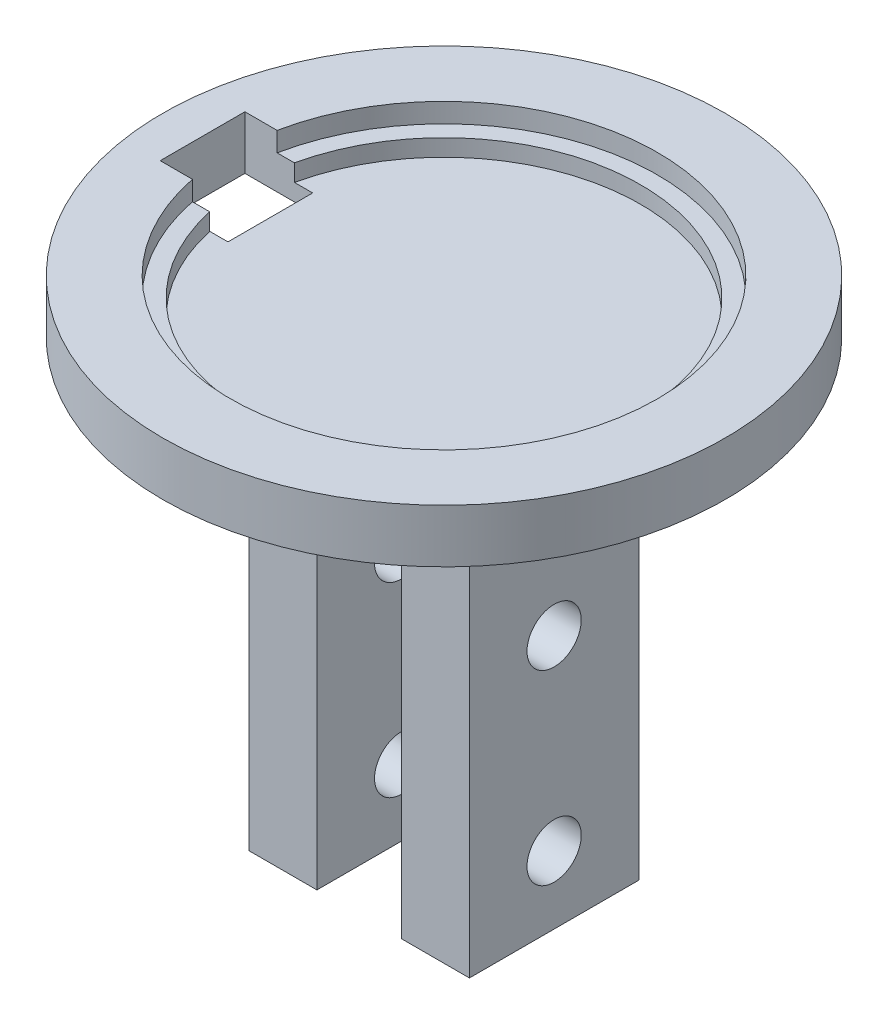
from build123d import *

# Parameters (mm, degrees)
SKETCH2_W           = 4
SKETCH2_H           = 10
BOSS_EXTRUDE1_DEPTH = 27
SKETCH3_R           = 1.6
CUT_EXTRUDE1_DEPTH  = 22.3
FILLET1_R           = 2.75
SKETCH6_W           = 4
SKETCH6_H           = 5
CUT_EXTRUDE4_DEPTH  = 10


with BuildPart() as part:
    # Sketch1 → Revolve1 (revolve)
    with BuildSketch(Plane.XY, mode=Mode.PRIVATE) as revolve1_sk:
        Polygon((-14.45, -3.342), (-10.45, -3.342), (-10.45, -4.492), (-9.45, -4.492), (-9.45, -5.492), (2.15, -5.492), (2.15, -6.492), (-14.45, -6.492), align=None)
    revolve(revolve1_sk.sketch.rotate(Axis((2.15, -6.492, 0), (0, 1, 0)), 270), axis=Axis((2.15, -6.492, 0), (0, 1, 0)))

    # Sketch2 → Boss-Extrude1 (add)
    with BuildSketch(Plane.XZ.offset(6.492)):
        with Locations((6.65, 0)):
            Rectangle(SKETCH2_W, SKETCH2_H)
        with Locations((-2.35, 0)):
            Rectangle(SKETCH2_W, SKETCH2_H)
    extrude(amount=BOSS_EXTRUDE1_DEPTH)

    # Sketch3 → Cut-Extrude1 (cut)
    with BuildSketch(Plane.ZY.offset(4.35)):
        with Locations((0, -29.492)):
            Circle(SKETCH3_R)
        with Locations((0, -18.492)):
            Circle(SKETCH3_R)
    extrude(amount=-CUT_EXTRUDE1_DEPTH, mode=Mode.SUBTRACT)

    # Fillet1
    # the kernel refuses this fillet: 2.75 mm, written as the material it adds along each edge
    with BuildSketch(Plane(origin=(-4.35, -6.492, -5), x_dir=(-1, 0, 0), z_dir=(0, 0, 1)), Plane(origin=(-0.35, -6.492, 5), x_dir=(1, 0, 0), z_dir=(0, 0, -1)), Plane(origin=(8.65, -6.492, 5), x_dir=(1, 0, 0), z_dir=(0, 0, -1)), Plane(origin=(4.65, -6.492, -5), x_dir=(-1, 0, 0), z_dir=(0, 0, 1))) as fillet1_piece_1:
        with BuildLine():
            CenterArc((FILLET1_R, FILLET1_R), FILLET1_R, 180, 90)
            Line((0, FILLET1_R), (0, 0))
            Line((0, 0), (FILLET1_R, 0))
        make_face()
    extrude(amount=10)
    with BuildSketch(Plane(origin=(6.525, -6.492, -5), x_dir=(0, 0, -1), z_dir=(-1, 0, 0))) as fillet1_piece_2_section:
        with BuildLine():
            CenterArc((FILLET1_R, FILLET1_R), FILLET1_R, 180, 90)
            Line((0, FILLET1_R), (0, 0))
            Line((0, 0), (FILLET1_R, 0))
        make_face()
    fillet1_piece_2 = extrude(amount=10.875, mode=Mode.PRIVATE)
    fillet1_piece_2 = split(fillet1_piece_2, bisect_by=Plane(origin=(4.65, -7.114586564, -5.622586564), z_dir=(1, 0, 0)), keep=Keep.TOP, mode=Mode.PRIVATE)
    add(fillet1_piece_2)
    with BuildSketch(Plane(origin=(-0.35, -6.492, -5), x_dir=(0, 0, -1), z_dir=(-1, 0, 0)), Plane(origin=(-4.35, -6.492, 5), x_dir=(0, 0, 1), z_dir=(1, 0, 0)), Plane(origin=(4.65, -6.492, 5), x_dir=(0, 0, 1), z_dir=(1, 0, 0)), Plane(origin=(8.65, -6.492, -5), x_dir=(0, 0, -1), z_dir=(-1, 0, 0))) as fillet1_piece_3:
        with BuildLine():
            CenterArc((FILLET1_R, FILLET1_R), FILLET1_R, 180, 90)
            Line((0, FILLET1_R), (0, 0))
            Line((0, 0), (FILLET1_R, 0))
        make_face()
    extrude(amount=4)
    with BuildSketch(Plane(origin=(-4.35, -6.492, 5), x_dir=(0, 0, 1), z_dir=(1, 0, 0))) as fillet1_piece_4_section:
        with BuildLine():
            CenterArc((FILLET1_R, FILLET1_R), FILLET1_R, 180, 90)
            Line((0, FILLET1_R), (0, 0))
            Line((0, 0), (FILLET1_R, 0))
        make_face()
    fillet1_piece_4 = extrude(amount=10.875, mode=Mode.PRIVATE)
    fillet1_piece_4 = split(fillet1_piece_4, bisect_by=Plane(origin=(4.65, -7.114586564, 5.622586564), z_dir=(1, 0, 0)), keep=Keep.TOP, mode=Mode.PRIVATE)
    add(fillet1_piece_4)
    with BuildSketch(Plane(origin=(-2.225, -6.492, 5), x_dir=(0, 0, 1), z_dir=(1, 0, 0))) as fillet1_piece_5_section:
        with BuildLine():
            CenterArc((FILLET1_R, FILLET1_R), FILLET1_R, 180, 90)
            Line((0, FILLET1_R), (0, 0))
            Line((0, 0), (FILLET1_R, 0))
        make_face()
    fillet1_piece_5 = extrude(amount=10.875, mode=Mode.PRIVATE)
    fillet1_piece_5 = split(fillet1_piece_5, bisect_by=Plane(origin=(-0.35, -7.114586564, 5.622586564), z_dir=(-1, 0, 0)), keep=Keep.TOP, mode=Mode.PRIVATE)
    add(fillet1_piece_5)
    with BuildSketch(Plane(origin=(8.65, -6.492, -5), x_dir=(0, 0, -1), z_dir=(-1, 0, 0))) as fillet1_piece_6_section:
        with BuildLine():
            CenterArc((FILLET1_R, FILLET1_R), FILLET1_R, 180, 90)
            Line((0, FILLET1_R), (0, 0))
            Line((0, 0), (FILLET1_R, 0))
        make_face()
    fillet1_piece_6 = extrude(amount=10.875, mode=Mode.PRIVATE)
    fillet1_piece_6 = split(fillet1_piece_6, bisect_by=Plane(origin=(-0.35, -7.114586564, -5.622586564), z_dir=(-1, 0, 0)), keep=Keep.TOP, mode=Mode.PRIVATE)
    add(fillet1_piece_6)
    with BuildSketch(Plane(origin=(-4.35, -6.492, -11.875), x_dir=(-1, 0, 0), z_dir=(0, 0, 1))) as fillet1_piece_7a_section:
        with BuildLine():
            CenterArc((FILLET1_R, FILLET1_R), FILLET1_R, 180, 90)
            Line((0, FILLET1_R), (0, 0))
            Line((0, 0), (FILLET1_R, 0))
        make_face()
    fillet1_piece_7a = extrude(amount=16.875, mode=Mode.PRIVATE)
    fillet1_piece_7a = split(fillet1_piece_7a, bisect_by=Plane(origin=(-4.972586564, -7.114586564, -5), z_dir=(0, 0, -1)), keep=Keep.TOP, mode=Mode.PRIVATE)
    with BuildSketch(Plane(origin=(-0.35, -6.492, -5), x_dir=(0, 0, -1), z_dir=(-1, 0, 0))) as fillet1_piece_7b_section:
        with BuildLine():
            CenterArc((FILLET1_R, FILLET1_R), FILLET1_R, 180, 90)
            Line((0, FILLET1_R), (0, 0))
            Line((0, 0), (FILLET1_R, 0))
        make_face()
    fillet1_piece_7b = extrude(amount=10.875, mode=Mode.PRIVATE)
    fillet1_piece_7b = split(fillet1_piece_7b, bisect_by=Plane(origin=(-4.35, -7.114586564, -5.622586564), z_dir=(-1, 0, 0)), keep=Keep.TOP, mode=Mode.PRIVATE)
    fillet1_piece_7 = fillet1_piece_7a & fillet1_piece_7b
    add(fillet1_piece_7)
    with BuildSketch(Plane(origin=(-4.35, -6.492, -5), x_dir=(-1, 0, 0), z_dir=(0, 0, 1))) as fillet1_piece_8a_section:
        with BuildLine():
            CenterArc((FILLET1_R, FILLET1_R), FILLET1_R, 180, 90)
            Line((0, FILLET1_R), (0, 0))
            Line((0, 0), (FILLET1_R, 0))
        make_face()
    fillet1_piece_8a = extrude(amount=16.875, mode=Mode.PRIVATE)
    fillet1_piece_8a = split(fillet1_piece_8a, bisect_by=Plane(origin=(-4.972586564, -7.114586564, 5), z_dir=(0, 0, 1)), keep=Keep.TOP, mode=Mode.PRIVATE)
    with BuildSketch(Plane(origin=(-11.225, -6.492, 5), x_dir=(0, 0, 1), z_dir=(1, 0, 0))) as fillet1_piece_8b_section:
        with BuildLine():
            CenterArc((FILLET1_R, FILLET1_R), FILLET1_R, 180, 90)
            Line((0, FILLET1_R), (0, 0))
            Line((0, 0), (FILLET1_R, 0))
        make_face()
    fillet1_piece_8b = extrude(amount=10.875, mode=Mode.PRIVATE)
    fillet1_piece_8b = split(fillet1_piece_8b, bisect_by=Plane(origin=(-4.35, -7.114586564, 5.622586564), z_dir=(-1, 0, 0)), keep=Keep.TOP, mode=Mode.PRIVATE)
    fillet1_piece_8 = fillet1_piece_8a & fillet1_piece_8b
    add(fillet1_piece_8)
    with BuildSketch(Plane(origin=(6.525, -6.492, -5), x_dir=(0, 0, -1), z_dir=(-1, 0, 0))) as fillet1_piece_9a_section:
        with BuildLine():
            CenterArc((FILLET1_R, FILLET1_R), FILLET1_R, 180, 90)
            Line((0, FILLET1_R), (0, 0))
            Line((0, 0), (FILLET1_R, 0))
        make_face()
    fillet1_piece_9a = extrude(amount=10.875, mode=Mode.PRIVATE)
    fillet1_piece_9a = split(fillet1_piece_9a, bisect_by=Plane(origin=(4.65, -7.114586564, -5.622586564), z_dir=(-1, 0, 0)), keep=Keep.TOP, mode=Mode.PRIVATE)
    fillet1_piece_9a = split(fillet1_piece_9a, bisect_by=Plane(origin=(-0.35, -7.114586564, -5.622586564), z_dir=(1, 0, 0)), keep=Keep.TOP, mode=Mode.PRIVATE)
    with BuildSketch(Plane(origin=(-0.35, -6.492, 5), x_dir=(1, 0, 0), z_dir=(0, 0, -1))) as fillet1_piece_9b_section:
        with BuildLine():
            CenterArc((FILLET1_R, FILLET1_R), FILLET1_R, 180, 90)
            Line((0, FILLET1_R), (0, 0))
            Line((0, 0), (FILLET1_R, 0))
        make_face()
    fillet1_piece_9b = extrude(amount=16.875, mode=Mode.PRIVATE)
    fillet1_piece_9b = split(fillet1_piece_9b, bisect_by=Plane(origin=(0.272586564, -7.114586564, -5), z_dir=(0, 0, -1)), keep=Keep.TOP, mode=Mode.PRIVATE)
    fillet1_piece_9 = fillet1_piece_9a & fillet1_piece_9b
    add(fillet1_piece_9)
    with BuildSketch(Plane(origin=(-0.35, -6.492, 11.875), x_dir=(1, 0, 0), z_dir=(0, 0, -1))) as fillet1_piece_10a_section:
        with BuildLine():
            CenterArc((FILLET1_R, FILLET1_R), FILLET1_R, 180, 90)
            Line((0, FILLET1_R), (0, 0))
            Line((0, 0), (FILLET1_R, 0))
        make_face()
    fillet1_piece_10a = extrude(amount=16.875, mode=Mode.PRIVATE)
    fillet1_piece_10a = split(fillet1_piece_10a, bisect_by=Plane(origin=(0.272586564, -7.114586564, 5), z_dir=(0, 0, 1)), keep=Keep.TOP, mode=Mode.PRIVATE)
    with BuildSketch(Plane(origin=(-4.35, -6.492, 5), x_dir=(0, 0, 1), z_dir=(1, 0, 0))) as fillet1_piece_10b_section:
        with BuildLine():
            CenterArc((FILLET1_R, FILLET1_R), FILLET1_R, 180, 90)
            Line((0, FILLET1_R), (0, 0))
            Line((0, 0), (FILLET1_R, 0))
        make_face()
    fillet1_piece_10b = extrude(amount=10.875, mode=Mode.PRIVATE)
    fillet1_piece_10b = split(fillet1_piece_10b, bisect_by=Plane(origin=(4.65, -7.114586564, 5.622586564), z_dir=(-1, 0, 0)), keep=Keep.TOP, mode=Mode.PRIVATE)
    fillet1_piece_10b = split(fillet1_piece_10b, bisect_by=Plane(origin=(-0.35, -7.114586564, 5.622586564), z_dir=(1, 0, 0)), keep=Keep.TOP, mode=Mode.PRIVATE)
    fillet1_piece_10 = fillet1_piece_10a & fillet1_piece_10b
    add(fillet1_piece_10)
    with BuildSketch(Plane(origin=(8.65, -6.492, 11.875), x_dir=(1, 0, 0), z_dir=(0, 0, -1))) as fillet1_piece_11a_section:
        with BuildLine():
            CenterArc((FILLET1_R, FILLET1_R), FILLET1_R, 180, 90)
            Line((0, FILLET1_R), (0, 0))
            Line((0, 0), (FILLET1_R, 0))
        make_face()
    fillet1_piece_11a = extrude(amount=16.875, mode=Mode.PRIVATE)
    fillet1_piece_11a = split(fillet1_piece_11a, bisect_by=Plane(origin=(9.272586564, -7.114586564, 5), z_dir=(0, 0, 1)), keep=Keep.TOP, mode=Mode.PRIVATE)
    with BuildSketch(Plane(origin=(4.65, -6.492, 5), x_dir=(0, 0, 1), z_dir=(1, 0, 0))) as fillet1_piece_11b_section:
        with BuildLine():
            CenterArc((FILLET1_R, FILLET1_R), FILLET1_R, 180, 90)
            Line((0, FILLET1_R), (0, 0))
            Line((0, 0), (FILLET1_R, 0))
        make_face()
    fillet1_piece_11b = extrude(amount=10.875, mode=Mode.PRIVATE)
    fillet1_piece_11b = split(fillet1_piece_11b, bisect_by=Plane(origin=(8.65, -7.114586564, 5.622586564), z_dir=(1, 0, 0)), keep=Keep.TOP, mode=Mode.PRIVATE)
    fillet1_piece_11 = fillet1_piece_11a & fillet1_piece_11b
    add(fillet1_piece_11)
    with BuildSketch(Plane(origin=(8.65, -6.492, 5), x_dir=(1, 0, 0), z_dir=(0, 0, -1))) as fillet1_piece_12a_section:
        with BuildLine():
            CenterArc((FILLET1_R, FILLET1_R), FILLET1_R, 180, 90)
            Line((0, FILLET1_R), (0, 0))
            Line((0, 0), (FILLET1_R, 0))
        make_face()
    fillet1_piece_12a = extrude(amount=16.875, mode=Mode.PRIVATE)
    fillet1_piece_12a = split(fillet1_piece_12a, bisect_by=Plane(origin=(9.272586564, -7.114586564, -5), z_dir=(0, 0, -1)), keep=Keep.TOP, mode=Mode.PRIVATE)
    with BuildSketch(Plane(origin=(15.525, -6.492, -5), x_dir=(0, 0, -1), z_dir=(-1, 0, 0))) as fillet1_piece_12b_section:
        with BuildLine():
            CenterArc((FILLET1_R, FILLET1_R), FILLET1_R, 180, 90)
            Line((0, FILLET1_R), (0, 0))
            Line((0, 0), (FILLET1_R, 0))
        make_face()
    fillet1_piece_12b = extrude(amount=10.875, mode=Mode.PRIVATE)
    fillet1_piece_12b = split(fillet1_piece_12b, bisect_by=Plane(origin=(8.65, -7.114586564, -5.622586564), z_dir=(1, 0, 0)), keep=Keep.TOP, mode=Mode.PRIVATE)
    fillet1_piece_12 = fillet1_piece_12a & fillet1_piece_12b
    add(fillet1_piece_12)
    with BuildSketch(Plane(origin=(-2.225, -6.492, 5), x_dir=(0, 0, 1), z_dir=(1, 0, 0))) as fillet1_piece_13a_section:
        with BuildLine():
            CenterArc((FILLET1_R, FILLET1_R), FILLET1_R, 180, 90)
            Line((0, FILLET1_R), (0, 0))
            Line((0, 0), (FILLET1_R, 0))
        make_face()
    fillet1_piece_13a = extrude(amount=10.875, mode=Mode.PRIVATE)
    fillet1_piece_13a = split(fillet1_piece_13a, bisect_by=Plane(origin=(4.65, -7.114586564, 5.622586564), z_dir=(-1, 0, 0)), keep=Keep.TOP, mode=Mode.PRIVATE)
    fillet1_piece_13a = split(fillet1_piece_13a, bisect_by=Plane(origin=(-0.35, -7.114586564, 5.622586564), z_dir=(1, 0, 0)), keep=Keep.TOP, mode=Mode.PRIVATE)
    with BuildSketch(Plane(origin=(4.65, -6.492, -5), x_dir=(-1, 0, 0), z_dir=(0, 0, 1))) as fillet1_piece_13b_section:
        with BuildLine():
            CenterArc((FILLET1_R, FILLET1_R), FILLET1_R, 180, 90)
            Line((0, FILLET1_R), (0, 0))
            Line((0, 0), (FILLET1_R, 0))
        make_face()
    fillet1_piece_13b = extrude(amount=16.875, mode=Mode.PRIVATE)
    fillet1_piece_13b = split(fillet1_piece_13b, bisect_by=Plane(origin=(4.027413436, -7.114586564, 5), z_dir=(0, 0, 1)), keep=Keep.TOP, mode=Mode.PRIVATE)
    fillet1_piece_13 = fillet1_piece_13a & fillet1_piece_13b
    add(fillet1_piece_13)
    with BuildSketch(Plane(origin=(4.65, -6.492, -11.875), x_dir=(-1, 0, 0), z_dir=(0, 0, 1))) as fillet1_piece_14a_section:
        with BuildLine():
            CenterArc((FILLET1_R, FILLET1_R), FILLET1_R, 180, 90)
            Line((0, FILLET1_R), (0, 0))
            Line((0, 0), (FILLET1_R, 0))
        make_face()
    fillet1_piece_14a = extrude(amount=16.875, mode=Mode.PRIVATE)
    fillet1_piece_14a = split(fillet1_piece_14a, bisect_by=Plane(origin=(4.027413436, -7.114586564, -5), z_dir=(0, 0, -1)), keep=Keep.TOP, mode=Mode.PRIVATE)
    with BuildSketch(Plane(origin=(8.65, -6.492, -5), x_dir=(0, 0, -1), z_dir=(-1, 0, 0))) as fillet1_piece_14b_section:
        with BuildLine():
            CenterArc((FILLET1_R, FILLET1_R), FILLET1_R, 180, 90)
            Line((0, FILLET1_R), (0, 0))
            Line((0, 0), (FILLET1_R, 0))
        make_face()
    fillet1_piece_14b = extrude(amount=10.875, mode=Mode.PRIVATE)
    fillet1_piece_14b = split(fillet1_piece_14b, bisect_by=Plane(origin=(4.65, -7.114586564, -5.622586564), z_dir=(-1, 0, 0)), keep=Keep.TOP, mode=Mode.PRIVATE)
    fillet1_piece_14b = split(fillet1_piece_14b, bisect_by=Plane(origin=(-0.35, -7.114586564, -5.622586564), z_dir=(1, 0, 0)), keep=Keep.TOP, mode=Mode.PRIVATE)
    fillet1_piece_14 = fillet1_piece_14a & fillet1_piece_14b
    add(fillet1_piece_14)

    # Sketch6 → Cut-Extrude4 (cut)
    with BuildSketch(Plane.XZ.offset(6.492)):
        with Locations((-10.1, 0)):
            Rectangle(SKETCH6_W, SKETCH6_H)
    extrude(amount=-CUT_EXTRUDE4_DEPTH, mode=Mode.SUBTRACT)


solid = part.part
